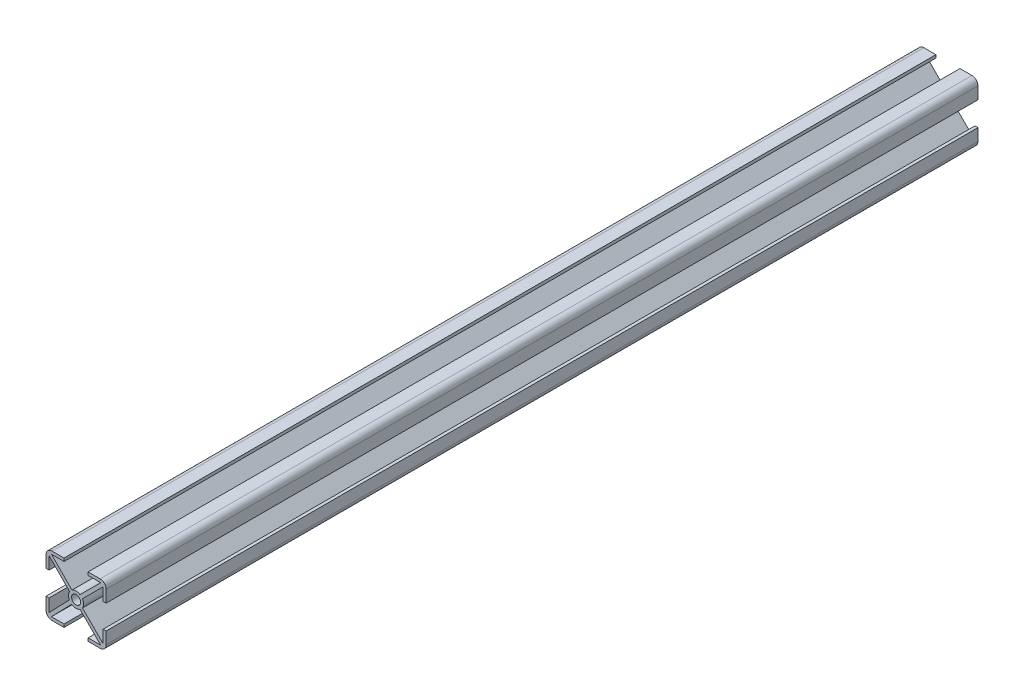
from build123d import *

# Parameters (mm, degrees)
ESQUISSE1_W             = 20
ESQUISSE1_H             = 20
ESQUISSE1_R             = 1.5
BOSS_EXTRU_1_DEPTH      = 290
CONG_1_R                = 2
ESQUISSE2_W             = 8
ESQUISSE2_H             = 1
ESQUISSE2_W_2           = 1
ESQUISSE2_H_2           = 8
ENL_V_MAT_EXTRU_1_DEPTH = 292.376045687


with BuildPart() as part:
    # Esquisse1 → Boss.-Extru.1 (new body)
    with BuildSketch(Plane.XY):
        with Locations((-10, 10)):
            Rectangle(ESQUISSE1_W, ESQUISSE1_H)
        with Locations((-10, 10)):
            Circle(ESQUISSE1_R, mode=Mode.SUBTRACT)
        with BuildLine():
            Line((-19, 18.2), (-12.144004756, 11.285785211))
            ThreePointArc((-12.144004756, 11.285785211), (-12.499292367, 10.059478285), (-12.20274135, 8.817658871))
            Line((-12.20274135, 8.817658871), (-19, 1.8))
            Line((-19, 1.8), (-19, 18.2))
        make_face(mode=Mode.SUBTRACT)
        with BuildLine():
            Line((-18.2, 1), (-1.8, 1))
            Line((-1.8, 1), (-8.678082464, 7.878082464))
            ThreePointArc((-8.678082464, 7.878082464), (-10.078866736, 7.501244302), (-11.453098741, 7.965668648))
            Line((-11.453098741, 7.965668648), (-18.2, 1))
        make_face(mode=Mode.SUBTRACT)
        with BuildLine():
            Line((-1, 18.2), (-1, 1.8))
            Line((-1, 1.8), (-7.878082464, 8.678082464))
            ThreePointArc((-7.878082464, 8.678082464), (-7.5, 10), (-7.878082464, 11.321917536))
            Line((-7.878082464, 11.321917536), (-1, 18.2))
        make_face(mode=Mode.SUBTRACT)
        with BuildLine():
            Line((-11.357461746, 12.099356475), (-18.2, 19))
            Line((-18.2, 19), (-1.8, 19))
            Line((-1.8, 19), (-8.678082464, 12.121917536))
            ThreePointArc((-8.678082464, 12.121917536), (-10.021049895, 12.499911379), (-11.357461746, 12.099356475))
        make_face(mode=Mode.SUBTRACT)
    extrude(amount=BOSS_EXTRU_1_DEPTH)

    # Congé1
    cong_1_edges = [part.edges().sort_by_distance(p)[0] for p in [
        (0, 0, 145),
        (-20, 0, 145),
        (-20, 20, 145),
        (0, 20, 145),
    ]]
    fillet(cong_1_edges, radius=CONG_1_R)

    # Esquisse2 → Enlèv. mat.-Extru.1 (cut, through all)
    with BuildSketch(Plane.XY.offset(290)):
        with Locations((-10, 19.5)):
            Rectangle(ESQUISSE2_W, ESQUISSE2_H)
        with Locations((-19.5, 10)):
            Rectangle(ESQUISSE2_W_2, ESQUISSE2_H_2)
        with Locations((-10, 0.5)):
            Rectangle(ESQUISSE2_W, ESQUISSE2_H)
        with Locations((-0.5, 10)):
            Rectangle(ESQUISSE2_W_2, ESQUISSE2_H_2)
    extrude(amount=-ENL_V_MAT_EXTRU_1_DEPTH, mode=Mode.SUBTRACT)


solid = part.part
